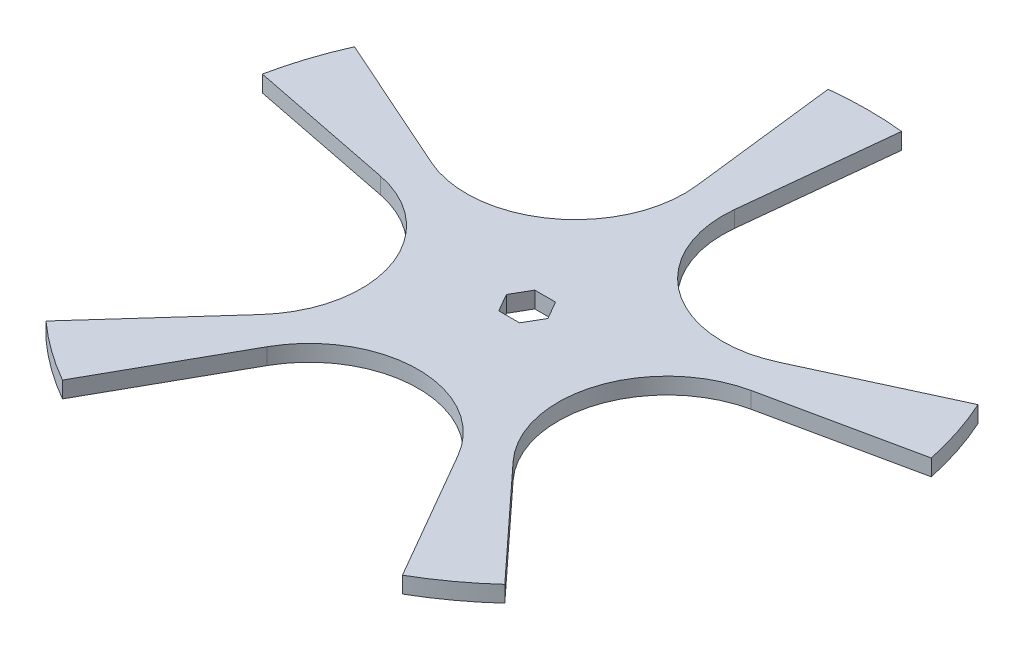
from build123d import *

# Parameters (mm, degrees)
SKETCH1_R           = 125
BOSS_EXTRUDE1_DEPTH = 6
CUT_EXTRUDE1_DEPTH  = 6
CIRPATTERN1_COUNT   = 5


with BuildPart() as part:
    # Sketch1 → Boss-Extrude1 (new body)
    with BuildSketch(Plane(origin=(0, 0, 0), x_dir=(1, 0, 0), z_dir=(0, 1, 0))):
        Circle(SKETCH1_R)
        Polygon((7.621023553, 0), (3.810511777, 6.6), (-3.810511777, 6.6), (-7.621023553, 0), (-3.810511777, -6.6), (3.810511777, -6.6), align=None, mode=Mode.SUBTRACT)
    extrude(amount=BOSS_EXTRUDE1_DEPTH)

    # Sketch2 → Cut-Extrude1 (cut)
    with BuildSketch(Plane(origin=(0, 6, 0), x_dir=(1, 0, 0), z_dir=(0, 1, 0))):
        with BuildLine():
            Line((-34.904628053, -60.463701975), (-61.858518279, -108.621009553))
            Line((-61.858518279, -108.621009553), (-61.858518279, -164.815931555))
            Line((-61.858518279, -164.815931555), (62.5, -162.124092122))
            Line((62.5, -162.124092122), (62.5, -108.253175473))
            Line((62.5, -108.253175473), (34.641016151, -60))
            ThreePointArc((34.641016151, -60), (-0.266697748, -40.000889106), (-34.904628053, -60.463701975))
        make_face()
    cut_extrude1 = extrude(amount=-CUT_EXTRUDE1_DEPTH, mode=Mode.SUBTRACT)

    # CirPattern1: Cut-Extrude1 ×5 about axis
    cirpattern1_axis = Axis((0, 6, 0), (0, 1, 0))
    for i in range(1, CIRPATTERN1_COUNT):
        add(cut_extrude1.rotate(cirpattern1_axis, i * 360 / CIRPATTERN1_COUNT), mode=Mode.SUBTRACT)


solid = part.part
